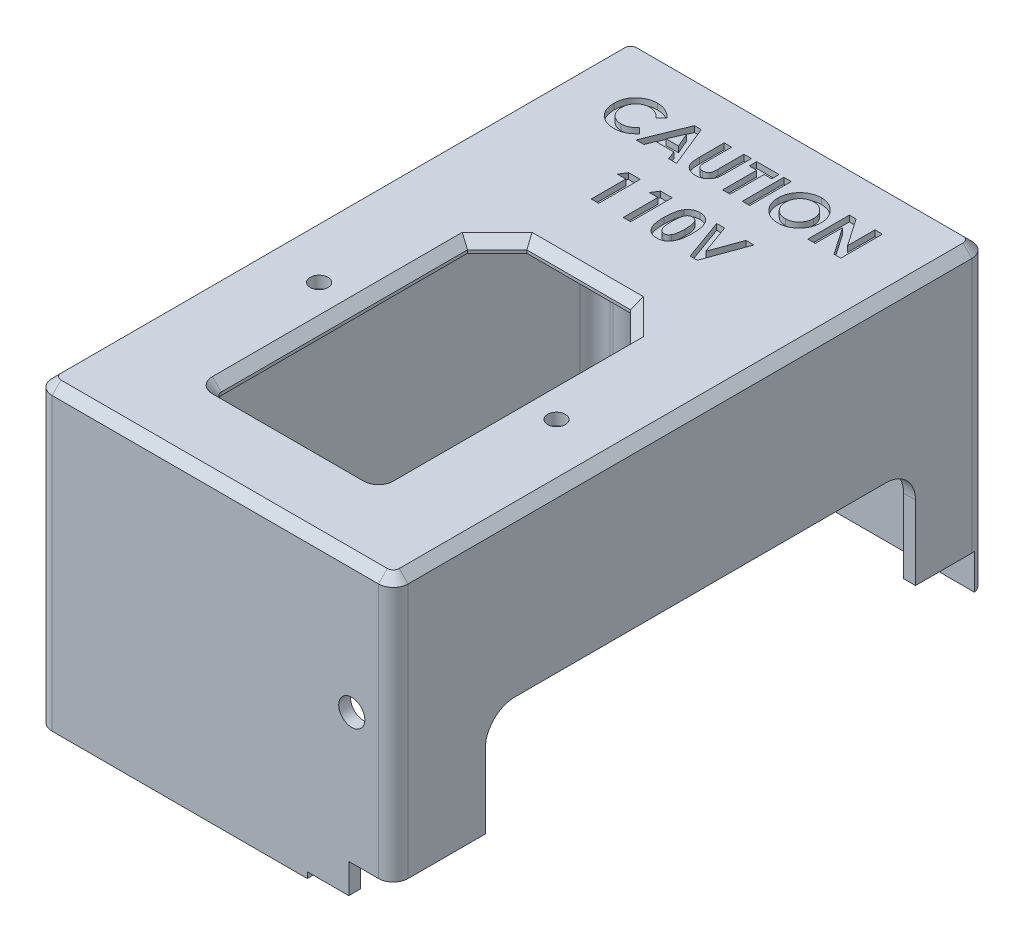
from build123d import *

# Parameters (mm, degrees)
SKETCH1_W           = 60
SKETCH1_H           = 100
SKETCH1_R           = 1.5
BOSS_EXTRUDE1_DEPTH = 2
SKETCH2_W           = 60
SKETCH2_H           = 100
SKETCH2_W_2         = 56
SKETCH2_H_2         = 96
BOSS_EXTRUDE2_DEPTH = 25
BOSS_EXTRUDE3_DEPTH = 17.5
BOSS_EXTRUDE4_DEPTH = 5
FILLET1_R           = 2.5
CHAMFER1_SIZE       = 1.5
CUT_EXTRUDE1_REACH  = 127.922
BOSS_EXTRUDE5_DEPTH = 47.5
SKETCH9_R           = 1.5
CUT_EXTRUDE2_DEPTH  = 42.5
FILLET2_R           = 2.5
WRAP2_START         = -1
WRAP2_OUTLINE_W     = 1.256410257
WRAP2_OUTLINE_H     = 7
WRAP2_DEPTH         = 1
BOSS_EXTRUDE6_START = 1
SKETCH11_R          = 1.5
BOSS_EXTRUDE6_DEPTH = 1
FILLET3_R           = 5
BOSS_EXTRUDE7_DEPTH = 5
BOSS_EXTRUDE8_DEPTH = 1
CUT_EXTRUDE3_REACH  = 128.302
SKETCH15_R          = 2.2


# Read off the part's stored shape, not the designer's step: Wrap2
with BuildPart() as part:
    # Sketch1 → Boss-Extrude1 (new body)
    with BuildSketch(Plane(origin=(0, 0, 0), x_dir=(1, 0, 0), z_dir=(0, 1, 0))):
        with Locations((30, 50)):
            Rectangle(SKETCH1_W, SKETCH1_H)
        with Locations(Location((50, 37.5, 0), (0, 0, 270))):
            Circle(SKETCH1_R, mode=Mode.SUBTRACT)
        with Locations(Location((10, 37.5, 0), (0, 0, 270))):
            Circle(SKETCH1_R, mode=Mode.SUBTRACT)
        with BuildLine():
            Line((16.25, 56.25), (21.25, 61.25))
            Line((21.25, 61.25), (38.75, 61.25))
            Line((38.75, 61.25), (43.75, 56.25))
            Line((43.75, 56.25), (43.75, 14.75))
            ThreePointArc((43.75, 14.75), (43.457106781, 14.042893219), (42.75, 13.75))
            Line((42.75, 13.75), (17.25, 13.75))
            ThreePointArc((17.25, 13.75), (16.542893219, 14.042893219), (16.25, 14.75))
            Line((16.25, 14.75), (16.25, 56.25))
        make_face(mode=Mode.SUBTRACT)
    extrude(amount=BOSS_EXTRUDE1_DEPTH)

    # Sketch2 → Boss-Extrude2 (add)
    with BuildSketch(Plane.XZ):
        with Locations((30, -50)):
            Rectangle(SKETCH2_W, SKETCH2_H)
        with Locations((30, -50)):
            Rectangle(SKETCH2_W_2, SKETCH2_H_2, mode=Mode.SUBTRACT)
    extrude(amount=BOSS_EXTRUDE2_DEPTH)

    # Sketch3 → Boss-Extrude3 (add)
    with BuildSketch(Plane.XZ.offset(25)):
        Polygon((58.450874289, 0), (0, 0), (0, -100), (58, -100), (60, -100), (60, -88), (58, -88), (58, -98), (2, -98), (2, -2), (58, -2), (58, -15.5), (60, -15.5), (60, 0), align=None)
    extrude(amount=BOSS_EXTRUDE3_DEPTH)

    # Sketch5 → Boss-Extrude4 (add)
    with BuildSketch(Plane.XZ.offset(42.5)):
        Polygon((52.5, 0), (0, 0), (0, -2), (0, -98), (0, -100), (52.5, -100), (52.5, -98), (2, -98), (2, -2), (52.5, -2), align=None)
    extrude(amount=BOSS_EXTRUDE4_DEPTH)

    # Fillet1
    fillet1_edges = [part.edges().sort_by_distance(p)[0] for p in [
        (2, -23.75, -2),
        (2, -23.75, -98),
        (0, -22.75, -100),
        (60, -20.25, -100),
        (60, -20.25, 0),
        (0, -22.75, 0),
    ]]
    fillet(fillet1_edges, radius=FILLET1_R)

    # Chamfer1
    chamfer1_edges = [part.edges().sort_by_distance(p)[0] for p in [
        (60, 2, -50),
        (30, 2, 0),
        (0, 2, -50),
        (30, 2, -100),
        (0.732233047, 2, -99.267766953),
        (0.732233047, 2, -0.732233047),
        (59.267766953, 2, -99.267766953),
        (59.267766953, 2, -0.732233047),
        (41.25, 2, -58.75),
        (30, 2, -61.25),
        (18.75, 2, -58.75),
        (16.25, 2, -35.5),
        (16.542893219, 2, -14.042893219),
        (30, 2, -13.75),
        (43.457106781, 2, -14.042893219),
        (43.75, 2, -35.5),
    ]]
    chamfer(chamfer1_edges, length=CHAMFER1_SIZE)

    # Sketch7 → Cut-Extrude1 (cut, up to next)
    with BuildSketch(Plane.ZY, mode=Mode.PRIVATE) as cut_extrude1_sk1:
        with BuildLine():
            Line((-58.75, -47.5), (-58.75, -45))
            ThreePointArc((-58.75, -45), (-58.017766953, -43.232233047), (-56.25, -42.5))
            Line((-56.25, -42.5), (-46.25, -42.5))
            ThreePointArc((-46.25, -42.5), (-44.482233047, -43.232233047), (-43.75, -45))
            Line((-43.75, -45), (-43.75, -47.5))
            Line((-43.75, -47.5), (-58.75, -47.5))
        make_face()
    cut_extrude1_tool1 = extrude(cut_extrude1_sk1.sketch, amount=-CUT_EXTRUDE1_REACH, mode=Mode.PRIVATE) & part.part
    add(cut_extrude1_tool1.solids().sort_by_distance((0, -45.07202, -51.25))[0], mode=Mode.SUBTRACT)

    # Sketch8 → Boss-Extrude5 (add)
    with BuildSketch(Plane.XZ.offset(47.5)):
        with BuildLine():
            Line((5, -92), (2, -92))
            Line((2, -92), (2, -95.5))
            ThreePointArc((2, -95.5), (2.732233047, -97.267766953), (4.5, -98))
            Line((4.5, -98), (8, -98))
            Line((8, -98), (8, -95))
            ThreePointArc((8, -95), (7.121320344, -92.878679656), (5, -92))
        make_face()
        with BuildLine():
            Line((8, -5), (8, -2))
            Line((8, -2), (4.5, -2))
            ThreePointArc((4.5, -2), (2.732233047, -2.732233047), (2, -4.5))
            Line((2, -4.5), (2, -8))
            Line((2, -8), (5, -8))
            ThreePointArc((5, -8), (7.121320344, -7.121320344), (8, -5))
        make_face()
    extrude(amount=-BOSS_EXTRUDE5_DEPTH)

    # Sketch9 → Cut-Extrude2 (cut)
    with BuildSketch(Plane.XZ.offset(47.5)):
        with Locations(Location((5, -5, 0), (0, 0, 270))):
            Circle(SKETCH9_R)
        with Locations(Location((5, -95, 0), (0, 0, 270))):
            Circle(SKETCH9_R)
    extrude(amount=-CUT_EXTRUDE2_DEPTH, mode=Mode.SUBTRACT)

    # Fillet2
    fillet2_edges = [part.edges().sort_by_distance(p)[0] for p in [
        (2, -23.75, -8),
        (8, -23.75, -2),
        (8, -23.75, -98),
        (2, -23.75, -92),
    ]]
    fillet(fillet2_edges, radius=FILLET2_R)

    # Wrap2 outline → Wrap2 (cut)
    # profile 1 of 11: a face of its own
    with BuildSketch(Plane(origin=(0, 2, 0), x_dir=(1, 0, 0), z_dir=(0, 1, 0)).offset(WRAP2_START)):
        with BuildLine():
            add(Edge.make_bspline(
                [(43.596153846, 88.478966346), (43.592880746, 88.353544519), (43.586430998, 88.106396785), (43.536600624, 87.743190399), (43.453381259, 87.394906439), (43.338733521, 87.060756556), (43.188395151, 86.742359259), (43.007255065, 86.437681624), (42.790533321, 86.149551132), (42.546134612, 85.878122407), (42.277072843, 85.631742596), (41.992093717, 85.414620814), (41.692513091, 85.230640009), (41.378769455, 85.079884454), (41.050190002, 84.962888619), (40.707586363, 84.880339557), (40.350979738, 84.830172825), (40.108469939, 84.823765206), (39.985376603, 84.820512821)],
                knots=[0, 0, 0, 0, 0.065722315, 0.129507931, 0.191722103, 0.253161125, 0.314315704, 0.37595174, 0.438619601, 0.502972902, 0.567128646, 0.62955229, 0.690476782, 0.751072338, 0.811667894, 0.872929356, 0.935501371, 1, 1, 1, 1], degree=3))
            add(Edge.make_bspline(
                [(39.975560897, 92.179487179), (40.097264476, 92.176336056), (40.337534907, 92.170115024), (40.690886005, 92.11825787), (41.031405122, 92.033764071), (41.358938277, 91.916311579), (41.672665364, 91.762719183), (41.973693004, 91.57734133), (42.26094293, 91.356679122), (42.531471635, 91.105880246), (42.781488949, 90.833147419), (42.998129097, 90.539502043), (43.182871868, 90.232552764), (43.335987171, 89.911477103), (43.452612974, 89.574051457), (43.534454123, 89.221996252), (43.587033007, 88.855411644), (43.593080388, 88.605817493), (43.596153846, 88.478966346)],
                knots=[0, 0, 0, 0, 0.063395597, 0.125157267, 0.185649467, 0.245976679, 0.306108369, 0.367350588, 0.429902078, 0.494539958, 0.559372583, 0.622409686, 0.684357426, 0.745806601, 0.807430275, 0.869995516, 0.933927868, 1, 1, 1, 1], degree=3))
            add(Edge.make_bspline(
                [(36.326923077, 88.502804487), (36.327990689, 88.585603998), (36.330112394, 88.750154589), (36.355670573, 88.994010164), (36.392467001, 89.233106006), (36.446887172, 89.466488836), (36.512993772, 89.695805061), (36.598644209, 89.918920149), (36.696137586, 90.138217583), (36.810049418, 90.351107186), (36.93670836, 90.555630195), (37.074904543, 90.750821839), (37.224985459, 90.934321967), (37.386467648, 91.107336465), (37.559907598, 91.268728097), (37.743023888, 91.420781585), (37.939367906, 91.55945785), (38.144642297, 91.68814364), (38.357689773, 91.804511969), (38.577643037, 91.90356121), (38.799970617, 91.990059226), (39.027642509, 92.058327284), (39.258218805, 92.113930903), (39.494162744, 92.150702531), (39.733342708, 92.176260001), (39.89462989, 92.1784089), (39.975560897, 92.179487179)],
                knots=[0, 0, 0, 0, 0.043114346, 0.085682765, 0.127594324, 0.169058623, 0.210432029, 0.251811166, 0.29344384, 0.335380853, 0.377476606, 0.418688491, 0.459873034, 0.500872905, 0.541872776, 0.583211777, 0.624763202, 0.666987622, 0.709369706, 0.751102652, 0.79256838, 0.833545109, 0.874827423, 0.916017723, 0.957859204, 1, 1, 1, 1], degree=3))
            add(Edge.make_bspline(
                [(39.985376603, 84.820512821), (39.856635732, 84.82343037), (39.603677519, 84.829162956), (39.233472041, 84.883677235), (38.878783205, 84.965794782), (38.542590601, 85.088350815), (38.221470395, 85.241556163), (37.917781951, 85.430237733), (37.631627329, 85.654083716), (37.364647958, 85.907361332), (37.122764001, 86.184502596), (36.909253963, 86.477277765), (36.72915351, 86.783450294), (36.582456052, 87.103163478), (36.466805669, 87.434430378), (36.385227464, 87.779268505), (36.337037272, 88.136850811), (36.330324658, 88.379727861), (36.326923077, 88.502804487)],
                knots=[0, 0, 0, 0, 0.066748651, 0.131151976, 0.193732197, 0.255325543, 0.316388186, 0.378026863, 0.440405679, 0.504557429, 0.568658287, 0.630986179, 0.692288135, 0.752615447, 0.813199538, 0.874016125, 0.936158356, 1, 1, 1, 1], degree=3))
        make_face()
        with BuildLine():
            add(Edge.make_bspline(
                [(37.583333333, 88.485977564), (37.586176788, 88.390029231), (37.591749488, 88.201986397), (37.630959683, 87.927674577), (37.698044423, 87.668614288), (37.794913483, 87.426072556), (37.915056532, 87.197356136), (38.06425513, 86.985268273), (38.240092968, 86.788539084), (38.375557013, 86.673680389), (38.444310897, 86.615384615)],
                knots=[0, 0, 0, 0, 0.134806833, 0.264199056, 0.388461817, 0.509942098, 0.630409611, 0.750671035, 0.873454726, 1, 1, 1, 1], degree=3))
            add(Edge.make_bspline(
                [(39.955929487, 90.923076923), (39.874022995, 90.920879188), (39.712372354, 90.916541738), (39.475260304, 90.883496239), (39.247624363, 90.83071882), (39.030726405, 90.754271373), (38.823626378, 90.656973176), (38.625957156, 90.539164201), (38.44045605, 90.396794894), (38.264649581, 90.237508431), (38.105837366, 90.060026704), (37.965521765, 89.86982485), (37.848100206, 89.667220503), (37.749758915, 89.454095808), (37.675729719, 89.228054236), (37.623000942, 88.990866394), (37.589678323, 88.742123597), (37.585477965, 88.572555955), (37.583333333, 88.485977564)],
                knots=[0, 0, 0, 0, 0.064608735, 0.12751179, 0.188521308, 0.248708179, 0.308598265, 0.368812249, 0.429887502, 0.492802448, 0.555743332, 0.617485295, 0.678968963, 0.740197691, 0.802360102, 0.866244776, 0.931706828, 1, 1, 1, 1], degree=3))
            add(Edge.make_bspline(
                [(42.33974359, 88.495793269), (42.337529107, 88.579093697), (42.333170237, 88.743057885), (42.300474099, 88.984099473), (42.245587944, 89.215058869), (42.169583572, 89.436313255), (42.072530013, 89.648079541), (41.952513442, 89.849613034), (41.809954982, 90.040718898), (41.648135607, 90.22009482), (41.472005162, 90.384929803), (41.282911531, 90.527976604), (41.086145766, 90.652279726), (40.8771931, 90.749653772), (40.660328529, 90.827231469), (40.434228735, 90.884360798), (40.19803735, 90.916309592), (40.037351467, 90.920801039), (39.955929487, 90.923076923)],
                knots=[0, 0, 0, 0, 0.065939124, 0.129791109, 0.192175236, 0.253617044, 0.314719108, 0.376282275, 0.438972992, 0.503174702, 0.567329465, 0.629650994, 0.690649867, 0.751237613, 0.811754114, 0.872787777, 0.935539633, 1, 1, 1, 1], degree=3))
            add(Edge.make_bspline(
                [(39.981169872, 86.076923077), (40.06166798, 86.079139446), (40.22005054, 86.083500223), (40.452748621, 86.116138914), (40.675680451, 86.171375364), (40.890230008, 86.247152187), (41.095778628, 86.345672047), (41.291321739, 86.467135087), (41.477202181, 86.610049899), (41.652784674, 86.771428142), (41.813275373, 86.949609024), (41.953298165, 87.140825395), (42.074453142, 87.340864187), (42.170749424, 87.552556644), (42.247703347, 87.773904489), (42.299797506, 88.005888025), (42.333401625, 88.247550926), (42.337603166, 88.412011071), (42.33974359, 88.495793269)],
                knots=[0, 0, 0, 0, 0.064147445, 0.126212115, 0.186841289, 0.246935869, 0.307256361, 0.368150502, 0.430070767, 0.493875442, 0.557980682, 0.620869526, 0.682524731, 0.744035698, 0.805888683, 0.868968138, 0.933247429, 1, 1, 1, 1], degree=3))
            add(Edge.make_bspline(
                [(38.444310897, 86.615384615), (38.500633454, 86.572317936), (38.612009612, 86.487154878), (38.789790207, 86.378000948), (38.972869214, 86.284445142), (39.162628193, 86.208853157), (39.358666382, 86.149393772), (39.5609569, 86.107755343), (39.769213116, 86.081623627), (39.91004573, 86.078500392), (39.981169872, 86.076923077)],
                knots=[0, 0, 0, 0, 0.127991026, 0.253098392, 0.376184058, 0.498936312, 0.621525881, 0.745706894, 0.87157535, 1, 1, 1, 1], degree=3))
        make_face(mode=Mode.SUBTRACT)
    # profile 2 of 11: a face of its own
    with BuildSketch(Plane(origin=(0, 2, 0), x_dir=(1, 0, 0), z_dir=(0, 1, 0)).offset(WRAP2_START)):
        with BuildLine():
            add(Edge.make_bspline(
                [(25.019230769, 87.445512821), (25.019299087, 87.398293873), (25.019431041, 87.307090963), (25.026036744, 87.176244648), (25.032081418, 87.055969489), (25.042987725, 86.94639716), (25.059100079, 86.84748079), (25.074702095, 86.758584977), (25.095817881, 86.681301299), (25.127551531, 86.593332239), (25.176442669, 86.494494196), (25.256328075, 86.391482921), (25.348509, 86.29747018), (25.458993149, 86.219217537), (25.58316756, 86.155918201), (25.720349952, 86.109020399), (25.870346946, 86.082951448), (25.974061639, 86.078971545), (26.02744391, 86.076923077)],
                knots=[0, 0, 0, 0, 0.072218748, 0.139489766, 0.200369998, 0.256432726, 0.307803522, 0.353658517, 0.394419906, 0.430155706, 0.496666273, 0.562017618, 0.628754548, 0.697409641, 0.768079195, 0.841338126, 0.918336247, 1, 1, 1, 1], degree=3))
            Line((25.019230769, 87.445512821), (25.019230769, 92))
            Line((25.019230769, 92), (23.762820513, 92))
            Line((23.762820513, 92), (23.762820513, 87.82411859))
            add(Edge.make_bspline(
                [(26.055488782, 84.820512821), (25.995147759, 84.821529185), (25.876096159, 84.823534452), (25.701009896, 84.841215669), (25.531754629, 84.867271134), (25.368648388, 84.905283374), (25.211125061, 84.954388089), (25.059226498, 85.014832573), (24.913517192, 85.086279675), (24.774812512, 85.168072236), (24.643283144, 85.25651681), (24.523072092, 85.354561343), (24.410042609, 85.454955073), (24.307460073, 85.561922992), (24.214553995, 85.674342121), (24.131515716, 85.792467239), (24.058468603, 85.916287852), (23.993575197, 86.048035819), (23.938032775, 86.194407416), (23.891208426, 86.360609139), (23.850301574, 86.549246034), (23.819902015, 86.760743091), (23.792341596, 86.994403239), (23.77489737, 87.250835198), (23.76577151, 87.530046325), (23.763829034, 87.723617611), (23.762820513, 87.82411859)],
                knots=[0, 0, 0, 0, 0.041714932, 0.082302706, 0.121571814, 0.160067124, 0.197993763, 0.235566172, 0.273004881, 0.310090333, 0.346846143, 0.382483572, 0.417271008, 0.451331619, 0.484852741, 0.518030851, 0.551068546, 0.584171, 0.619466744, 0.659157907, 0.703471547, 0.752840114, 0.806844312, 0.866141938, 0.930501747, 1, 1, 1, 1], degree=3))
            add(Edge.make_bspline(
                [(28.33974359, 87.82411859), (28.339569114, 87.739515432), (28.339233615, 87.576831811), (28.334081359, 87.343043998), (28.323113138, 87.129516333), (28.313901098, 86.936186422), (28.296072645, 86.763314714), (28.277499579, 86.610162996), (28.253826609, 86.477274004), (28.218602654, 86.325996036), (28.157816534, 86.151804995), (28.059821339, 85.951231564), (27.935422782, 85.754858025), (27.788389905, 85.564844623), (27.622376338, 85.388328296), (27.441062955, 85.23336981), (27.247330377, 85.102291639), (27.039154237, 84.998298805), (26.816711703, 84.917192234), (26.577801873, 84.862692703), (26.322587664, 84.825872136), (26.146306386, 84.822335068), (26.055488782, 84.820512821)],
                knots=[0, 0, 0, 0, 0.058540417, 0.112567512, 0.161779878, 0.206487156, 0.24645703, 0.281999707, 0.313212938, 0.339806474, 0.389412612, 0.44047348, 0.49395474, 0.549977877, 0.606488084, 0.6613185, 0.714691099, 0.767918471, 0.82193879, 0.878107374, 0.937202655, 1, 1, 1, 1], degree=3))
            Line((28.33974359, 87.82411859), (28.33974359, 92))
            Line((28.33974359, 92), (27.083333333, 92))
            Line((27.083333333, 92), (27.083333333, 87.612379808))
            add(Edge.make_bspline(
                [(26.02744391, 86.076923077), (26.084155985, 86.078577976), (26.19473493, 86.08180475), (26.353785139, 86.113479026), (26.501146059, 86.163915321), (26.633697558, 86.235900768), (26.751307725, 86.322187942), (26.850862267, 86.42058236), (26.929430346, 86.53128027), (26.980638096, 86.633407521), (27.009388726, 86.727406763), (27.030938756, 86.811391518), (27.046737312, 86.910485216), (27.061070281, 87.023140295), (27.069683291, 87.150523645), (27.079022696, 87.291610832), (27.082445675, 87.447367212), (27.083029097, 87.555823303), (27.083333333, 87.612379808)],
                knots=[0, 0, 0, 0, 0.078832604, 0.153710231, 0.224677759, 0.294808775, 0.362714787, 0.427103243, 0.488649766, 0.550900247, 0.585045833, 0.62527219, 0.671465864, 0.724549993, 0.783264732, 0.849073131, 0.921296295, 1, 1, 1, 1], degree=3))
        make_face()
    # profile 3 of 11: a face of its own
    with BuildSketch(Plane(origin=(0, 2, 0), x_dir=(1, 0, 0), z_dir=(0, 1, 0)).offset(WRAP2_START)):
        with BuildLine():
            add(Edge.make_bspline(
                [(34.307692308, 76.099759615), (34.307023777, 75.986631647), (34.305724834, 75.766826032), (34.291729638, 75.446899403), (34.267629249, 75.14624813), (34.236566928, 74.864903318), (34.194020045, 74.603013541), (34.144191731, 74.35990068), (34.084979533, 74.135652858), (34.013493974, 73.930775352), (33.936568465, 73.741967972), (33.851918095, 73.566970465), (33.761018305, 73.40530884), (33.665954065, 73.254544212), (33.561513602, 73.119121045), (33.452780329, 72.994434244), (33.335019804, 72.885233289), (33.2131902, 72.785890453), (33.082828408, 72.700038306), (32.945278812, 72.624953434), (32.798089144, 72.564050685), (32.64394242, 72.511080726), (32.480211179, 72.473054012), (32.309497086, 72.442881063), (32.129872815, 72.426205641), (32.007577376, 72.424136945), (31.944911859, 72.423076923)],
                knots=[0, 0, 0, 0, 0.068490874, 0.13307654, 0.193828987, 0.251082857, 0.304400837, 0.354408344, 0.401294782, 0.444700685, 0.485692492, 0.524676484, 0.562306759, 0.597946585, 0.632473549, 0.665752043, 0.6979853, 0.729586224, 0.760825197, 0.79235508, 0.824312604, 0.857156272, 0.890926887, 0.925960443, 0.962061323, 1, 1, 1, 1], degree=3))
            add(Edge.make_bspline(
                [(31.908453526, 79.782051282), (31.969268997, 79.781148459), (32.088848462, 79.779373268), (32.264966505, 79.760146505), (32.434616873, 79.731100229), (32.598463262, 79.690590801), (32.755326286, 79.636978017), (32.906347628, 79.572804434), (33.049729698, 79.494704014), (33.187301073, 79.406485578), (33.319008763, 79.306609804), (33.441687264, 79.192746263), (33.557576947, 79.067514963), (33.664169226, 78.929022629), (33.763824621, 78.778528996), (33.856215681, 78.616010202), (33.940635128, 78.440670824), (34.018029104, 78.25219445), (34.087235042, 78.047755901), (34.145527117, 77.825010176), (34.195522326, 77.583906409), (34.23772181, 77.323844455), (34.269617799, 77.04447863), (34.291116338, 76.745994531), (34.305869653, 76.428967591), (34.307073716, 76.211489715), (34.307692308, 76.099759615)],
                knots=[0, 0, 0, 0, 0.03663489, 0.072033982, 0.106625971, 0.140305694, 0.17361947, 0.206425673, 0.239067006, 0.271882881, 0.304839889, 0.338529034, 0.372616188, 0.40754825, 0.443718906, 0.481311509, 0.520112998, 0.560912903, 0.604024601, 0.650074564, 0.699572228, 0.752362539, 0.808788717, 0.868954213, 0.93267472, 1, 1, 1, 1], degree=3))
            add(Edge.make_bspline(
                [(30.126201923, 78.829927885), (30.180553967, 78.905645988), (30.286822923, 79.053689799), (30.472637162, 79.24804365), (30.67227037, 79.414264581), (30.889822898, 79.548590863), (31.121854063, 79.654520579), (31.37035597, 79.729337545), (31.634410943, 79.772929396), (31.815741898, 79.778965247), (31.908453526, 79.782051282)],
                knots=[0, 0, 0, 0, 0.132314034, 0.258700009, 0.380911821, 0.500534869, 0.620922618, 0.742375765, 0.868280834, 1, 1, 1, 1], degree=3))
            add(Edge.make_bspline(
                [(29.551282051, 76.033854167), (29.552480767, 76.189089697), (29.554793704, 76.488618653), (29.584104945, 76.921350907), (29.627126412, 77.321336915), (29.690314756, 77.6879076), (29.76844627, 78.022420632), (29.868497742, 78.322672415), (29.982399065, 78.592817606), (30.079457625, 78.752853244), (30.126201923, 78.829927885)],
                knots=[0, 0, 0, 0, 0.161071124, 0.310788808, 0.449903824, 0.578376317, 0.696617212, 0.805987323, 0.906561703, 1, 1, 1, 1], degree=3))
            add(Edge.make_bspline(
                [(31.944911859, 72.423076923), (31.882248033, 72.424157393), (31.75949052, 72.426274016), (31.579380527, 72.442757074), (31.407761735, 72.473176243), (31.242735116, 72.511372667), (31.085449229, 72.563933483), (30.935149893, 72.626658399), (30.792992779, 72.701274779), (30.658584277, 72.787326953), (30.532383296, 72.886005111), (30.412428673, 72.996253779), (30.298985755, 73.117793504), (30.19378029, 73.251985633), (30.095089316, 73.39703898), (30.003942026, 73.554609984), (29.920393195, 73.724469226), (29.841829401, 73.906853471), (29.773567408, 74.105689243), (29.712817404, 74.322752121), (29.663052599, 74.559851502), (29.623028413, 74.816911217), (29.591073126, 75.093386672), (29.567302065, 75.389411315), (29.553229132, 75.705123026), (29.551943811, 75.922127412), (29.551282051, 76.033854167)],
                knots=[0, 0, 0, 0, 0.038217338, 0.074867203, 0.110158082, 0.144453927, 0.178079726, 0.211170773, 0.243687054, 0.275871733, 0.308375516, 0.341263325, 0.375150339, 0.409655261, 0.445157367, 0.482073467, 0.520575756, 0.560553681, 0.603107575, 0.64868871, 0.697947678, 0.750767767, 0.807309402, 0.867655571, 0.931861222, 1, 1, 1, 1], degree=3))
        make_face()
        with BuildLine():
            add(Edge.make_bspline(
                [(30.807692308, 76.019831731), (30.808973791, 75.913252237), (30.811431131, 75.708878155), (30.82430153, 75.414981109), (30.850099175, 75.147511132), (30.882186237, 74.904655481), (30.927253826, 74.687989139), (30.979107004, 74.495462243), (31.043141069, 74.329529042), (31.117144768, 74.18778977), (31.1991072, 74.067212465), (31.288081026, 73.964721213), (31.381037005, 73.875968624), (31.480876596, 73.80387599), (31.587361611, 73.748627519), (31.699603097, 73.708887975), (31.817672382, 73.684561746), (31.89852501, 73.68118848), (31.939302885, 73.679487179)],
                knots=[0, 0, 0, 0, 0.11073428, 0.212341193, 0.305502126, 0.389834841, 0.466690458, 0.535261854, 0.596762914, 0.651065719, 0.701035551, 0.747860271, 0.791833397, 0.834284007, 0.87533389, 0.916034749, 0.957652281, 1, 1, 1, 1], degree=3))
            add(Edge.make_bspline(
                [(31.939302885, 78.525641026), (31.884325194, 78.523035192), (31.776539738, 78.517926376), (31.620137904, 78.474559733), (31.472660741, 78.407577615), (31.360478801, 78.326975108), (31.276511736, 78.249707939), (31.217843344, 78.179783664), (31.161266928, 78.101753213), (31.111295788, 78.012095472), (31.064109988, 77.91403195), (31.017995238, 77.807117498), (30.980193252, 77.688726065), (30.943053803, 77.560873873), (30.91051618, 77.420026147), (30.883256785, 77.265031615), (30.858902912, 77.09488233), (30.841915795, 76.909466847), (30.826078705, 76.708979154), (30.814725928, 76.492972644), (30.809979617, 76.26150559), (30.808470909, 76.102097664), (30.807692308, 76.019831731)],
                knots=[0, 0, 0, 0, 0.053833701, 0.10554263, 0.158054172, 0.211987336, 0.24020689, 0.26979351, 0.301343099, 0.334608061, 0.370284442, 0.408088838, 0.448681346, 0.492069297, 0.538664157, 0.590371054, 0.646387784, 0.707195376, 0.772946775, 0.843642601, 0.919308357, 1, 1, 1, 1], degree=3))
            add(Edge.make_bspline(
                [(33.051282051, 76.099759615), (33.05082036, 76.210093698), (33.049931683, 76.422467973), (33.033627029, 76.727356228), (33.010921552, 77.005821048), (32.977709995, 77.257240735), (32.93497729, 77.482225625), (32.88230907, 77.680761011), (32.820217157, 77.853238168), (32.746583547, 77.999485112), (32.66502975, 78.123774954), (32.578457904, 78.230405996), (32.486501949, 78.321444891), (32.389315665, 78.397234232), (32.284649642, 78.455142972), (32.174503137, 78.496031334), (32.058650341, 78.520767421), (31.979622333, 78.523994564), (31.939302885, 78.525641026)],
                knots=[0, 0, 0, 0, 0.112114796, 0.215801843, 0.310202692, 0.395992925, 0.473410231, 0.54277842, 0.604548022, 0.659357266, 0.708764362, 0.755355506, 0.798686994, 0.840016839, 0.880203447, 0.919733348, 0.959048606, 1, 1, 1, 1], degree=3))
            add(Edge.make_bspline(
                [(32.706330128, 74.160456731), (32.734640354, 74.212236481), (32.794004603, 74.320814418), (32.862701014, 74.504035638), (32.920525824, 74.710678891), (32.970294792, 74.941387272), (33.00433373, 75.197070723), (33.033648023, 75.476107932), (33.047787034, 75.779904019), (33.050086821, 75.990375043), (33.051282051, 76.099759615)],
                knots=[0, 0, 0, 0, 0.088870731, 0.186354716, 0.294077654, 0.412236528, 0.541778144, 0.682702607, 0.835096353, 1, 1, 1, 1], degree=3))
            add(Edge.make_bspline(
                [(31.939302885, 73.679487179), (31.978681391, 73.680651336), (32.055779611, 73.682930609), (32.168206082, 73.70632704), (32.274524542, 73.744364556), (32.374413982, 73.798171293), (32.468231692, 73.866594791), (32.55551915, 73.949935733), (32.635618051, 74.049024834), (32.682284034, 74.122563601), (32.706330128, 74.160456731)],
                knots=[0, 0, 0, 0, 0.124035433, 0.242845955, 0.360341682, 0.479042432, 0.59933411, 0.725488476, 0.858549429, 1, 1, 1, 1], degree=3))
        make_face(mode=Mode.SUBTRACT)
    # profile 4 of 11: a face of its own
    with BuildSketch(Plane(origin=(0, 2, 0), x_dir=(1, 0, 0), z_dir=(0, 1, 0)).offset(WRAP2_START)):
        with BuildLine():
            add(Edge.make_bspline(
                [(14.405649038, 89.905048077), (14.327499069, 89.985855276), (14.174847695, 90.143697053), (13.928868885, 90.352665654), (13.673059879, 90.526812709), (13.41239693, 90.67347825), (13.142191468, 90.784441185), (12.865567804, 90.865301745), (12.580759613, 90.914599372), (12.388012384, 90.920239893), (12.291065705, 90.923076923)],
                knots=[0, 0, 0, 0, 0.139406438, 0.272304448, 0.399525336, 0.522810878, 0.642662717, 0.761022621, 0.879800797, 1, 1, 1, 1], degree=3))
            Line((14.405649038, 89.905048077), (15.326923077, 90.785657051))
            add(Edge.make_bspline(
                [(12.340144231, 92.179487179), (12.410759195, 92.178429383), (12.551254925, 92.176324789), (12.760476643, 92.158780708), (12.968025104, 92.131227907), (13.17315722, 92.089656597), (13.377340306, 92.040306198), (13.577891168, 91.975688659), (13.777973603, 91.903660234), (13.974449616, 91.817564959), (14.16759346, 91.723584189), (14.352880434, 91.616959594), (14.53342149, 91.50425273), (14.705215946, 91.378793112), (14.871481884, 91.245131394), (15.031349883, 91.102643969), (15.183417009, 90.948955153), (15.278845893, 90.840364932), (15.326923077, 90.785657051)],
                knots=[0, 0, 0, 0, 0.062275778, 0.123904062, 0.185067241, 0.246840152, 0.30843533, 0.370241251, 0.432586589, 0.495924582, 0.559351071, 0.621942654, 0.684392867, 0.746985808, 0.809441465, 0.872507833, 0.935769297, 1, 1, 1, 1], degree=3))
            add(Edge.make_bspline(
                [(8.685897436, 88.511217949), (8.687050453, 88.597281987), (8.68933545, 88.767839876), (8.713350985, 89.019085465), (8.746830037, 89.264004974), (8.799941508, 89.500055325), (8.863962149, 89.730416554), (8.943580227, 89.952584902), (9.038668581, 90.167198903), (9.14616229, 90.374617834), (9.267768847, 90.57348288), (9.403616722, 90.762085475), (9.550208659, 90.941881597), (9.711067026, 91.110485917), (9.883854338, 91.269378814), (10.06935071, 91.417699216), (10.266440475, 91.557574206), (10.475657082, 91.685396746), (10.692936008, 91.801019028), (10.915536796, 91.903002819), (11.14291254, 91.988237783), (11.374101876, 92.058937041), (11.610081576, 92.111709039), (11.849167276, 92.151655738), (12.093393309, 92.173986199), (12.257369931, 92.177641837), (12.340144231, 92.179487179)],
                knots=[0, 0, 0, 0, 0.044663331, 0.088511806, 0.130925591, 0.172904037, 0.21400012, 0.25498502, 0.295291276, 0.335772442, 0.376180821, 0.416178408, 0.456350051, 0.496512167, 0.537040574, 0.578118744, 0.619724561, 0.66242197, 0.705298954, 0.747430001, 0.789432984, 0.831267421, 0.872825096, 0.91487011, 0.957027003, 1, 1, 1, 1], degree=3))
            add(Edge.make_bspline(
                [(12.320512821, 84.820512821), (12.189960293, 84.823840865), (11.934505285, 84.830352922), (11.560142632, 84.87860286), (11.20450816, 84.959493031), (10.866736678, 85.073894043), (10.54693559, 85.220035975), (10.245186709, 85.399199122), (9.961976389, 85.610907474), (9.699592411, 85.852679606), (9.462253615, 86.119696628), (9.252473605, 86.406399657), (9.078943573, 86.714197732), (8.934857848, 87.038543692), (8.822184706, 87.380917655), (8.742881915, 87.741689965), (8.693976463, 88.120512273), (8.688626137, 88.379256642), (8.685897436, 88.511217949)],
                knots=[0, 0, 0, 0, 0.067376243, 0.131836579, 0.194461068, 0.255345968, 0.31558834, 0.375627452, 0.436137852, 0.49777862, 0.559470361, 0.62027777, 0.680787689, 0.741491622, 0.803215436, 0.866492763, 0.931910443, 1, 1, 1, 1], degree=3))
            add(Edge.make_bspline(
                [(15.298878205, 86.156850962), (15.236089003, 86.096229958), (15.113537907, 85.977910722), (14.928672982, 85.809908449), (14.744040716, 85.658939731), (14.564101441, 85.519525064), (14.385907564, 85.395725937), (14.209477982, 85.28741871), (14.036809955, 85.191864136), (13.864317975, 85.110673698), (13.69092871, 85.041734583), (13.512531532, 84.982382529), (13.328581064, 84.932172828), (13.137953821, 84.891660193), (12.942427858, 84.859174528), (12.740173311, 84.837246893), (12.532472574, 84.822505673), (12.391585946, 84.821181052), (12.320512821, 84.820512821)],
                knots=[0, 0, 0, 0, 0.077782936, 0.151815657, 0.222539839, 0.290277535, 0.354640607, 0.415797753, 0.474709008, 0.5304261, 0.585579746, 0.640906165, 0.697901091, 0.755420321, 0.814521258, 0.874461831, 0.936669717, 1, 1, 1, 1], degree=3))
            Line((15.298878205, 86.156850962), (14.405649038, 87.094951923))
            add(Edge.make_bspline(
                [(12.314903846, 86.076923077), (12.40853548, 86.079631401), (12.592497293, 86.084952553), (12.862487704, 86.126563207), (13.119761669, 86.195010378), (13.325322335, 86.27584251), (13.486373688, 86.355665289), (13.608979701, 86.42949743), (13.735763876, 86.512086785), (13.864620433, 86.606550367), (13.996998756, 86.711754575), (14.130562059, 86.830003577), (14.268729589, 86.957403603), (14.359241768, 87.048331504), (14.405649038, 87.094951923)],
                knots=[0, 0, 0, 0, 0.117048429, 0.229969726, 0.340703508, 0.449355147, 0.505556512, 0.56530267, 0.628204956, 0.694728992, 0.765018834, 0.839580202, 0.9177498, 1, 1, 1, 1], degree=3))
            add(Edge.make_bspline(
                [(9.942307692, 88.514022436), (9.942982304, 88.455565852), (9.944311977, 88.340346725), (9.958867599, 88.169905657), (9.982305584, 88.004537527), (10.016226155, 87.844492824), (10.058644162, 87.689632851), (10.108410143, 87.538621639), (10.170840834, 87.393545824), (10.240139843, 87.252720443), (10.320733791, 87.119988094), (10.407628936, 86.993416783), (10.501852533, 86.87362695), (10.604014874, 86.761108301), (10.715553768, 86.657619248), (10.833586346, 86.560047755), (10.960103655, 86.470836364), (11.092477609, 86.387746219), (11.231851753, 86.315565103), (11.374444543, 86.250182957), (11.522417972, 86.197082934), (11.673970376, 86.154279471), (11.828560159, 86.117881518), (11.987699354, 86.09547018), (12.150008422, 86.078498336), (12.259702108, 86.077450423), (12.314903846, 86.076923077)],
                knots=[0, 0, 0, 0, 0.045985853, 0.090639062, 0.134485273, 0.177331356, 0.219264833, 0.260785002, 0.302316572, 0.343435729, 0.384181474, 0.424375739, 0.464181122, 0.504011983, 0.543822462, 0.583802465, 0.624418535, 0.66554756, 0.70667494, 0.747826979, 0.788895117, 0.830219358, 0.871706937, 0.913733854, 0.956587828, 1, 1, 1, 1], degree=3))
            add(Edge.make_bspline(
                [(12.291065705, 90.923076923), (12.210103447, 90.92083557), (12.05033335, 90.916412506), (11.81574898, 90.883987086), (11.591356907, 90.828846247), (11.376389, 90.752851958), (11.171477813, 90.654519381), (10.976193723, 90.533924623), (10.791018195, 90.392156826), (10.618397291, 90.229949504), (10.460489755, 90.052725815), (10.320968392, 89.863628562), (10.20409687, 89.663090955), (10.108182313, 89.453143893), (10.033468581, 89.232815637), (9.980113589, 89.002254519), (9.949254488, 88.76118596), (9.94464856, 88.59730935), (9.942307692, 88.514022436)],
                knots=[0, 0, 0, 0, 0.064714517, 0.127706968, 0.188882163, 0.249158299, 0.309661029, 0.370224886, 0.432332222, 0.495781859, 0.559304077, 0.621860558, 0.683321537, 0.744522975, 0.806088371, 0.868994315, 0.933419057, 1, 1, 1, 1], degree=3))
        make_face()
    # profile 5 of 11: a face of its own
    with BuildSketch(Plane(origin=(0, 2, 0), x_dir=(1, 0, 0), z_dir=(0, 1, 0)).offset(WRAP2_START)):
        Polygon((50.416666667, 85), (50.416666667, 92), (49.16025641, 92), (49.16025641, 87.393629808), (45.984174679, 92), (44.852564103, 92), (44.852564103, 85), (46.108974359, 85), (46.108974359, 89.592347756), (49.276642628, 85), align=None)
    # profile 6 of 11: a face of its own
    with BuildSketch(Plane(origin=(0, 2, 0), x_dir=(1, 0, 0), z_dir=(0, 1, 0)).offset(WRAP2_START)):
        with Locations((34.442307693, 88.5)):
            Rectangle(WRAP2_OUTLINE_W, WRAP2_OUTLINE_H)
    # profile 7 of 11: a face of its own
    with BuildSketch(Plane(origin=(0, 2, 0), x_dir=(1, 0, 0), z_dir=(0, 1, 0)).offset(WRAP2_START)):
        Polygon((33.006410256, 90.743589744), (33.006410256, 92), (29.237179487, 92), (29.237179487, 90.743589744), (30.493589744, 90.743589744), (30.493589744, 85), (31.75, 85), (31.75, 90.743589744), align=None)
    # profile 8 of 11: a face of its own
    with BuildSketch(Plane(origin=(0, 2, 0), x_dir=(1, 0, 0), z_dir=(0, 1, 0)).offset(WRAP2_START)):
        Polygon((22.730769231, 85), (19.903846154, 92), (18.738581731, 92), (15.91025641, 85), (17.250801282, 85), (17.794871795, 86.435897436), (20.844751603, 86.435897436), (21.388822115, 85), align=None)
        Polygon((19.320512821, 90.122395833), (20.369391026, 87.692307692), (18.271634615, 87.692307692), align=None, mode=Mode.SUBTRACT)
    # profile 9 of 11: a face of its own
    with BuildSketch(Plane(origin=(0, 2, 0), x_dir=(1, 0, 0), z_dir=(0, 1, 0)).offset(WRAP2_START)):
        Polygon((26.141025641, 72.602564103), (27.397435897, 72.602564103), (27.397435897, 79.602564103), (25.455328526, 79.602564103), (24.705128205, 78.435897436), (26.141025641, 78.435897436), align=None)
    # profile 10 of 11: a face of its own
    with BuildSketch(Plane(origin=(0, 2, 0), x_dir=(1, 0, 0), z_dir=(0, 1, 0)).offset(WRAP2_START)):
        Polygon((20.756410256, 78.435897436), (20.756410256, 72.602564103), (22.012820513, 72.602564103), (22.012820513, 79.602564103), (20.070713141, 79.602564103), (19.320512821, 78.435897436), align=None)
    # profile 11 of 11: a face of its own
    with BuildSketch(Plane(origin=(0, 2, 0), x_dir=(1, 0, 0), z_dir=(0, 1, 0)).offset(WRAP2_START)):
        Polygon((34.891025641, 79.602564103), (37.424879808, 72.602564103), (38.635016026, 72.602564103), (41.173076923, 79.602564103), (39.835336538, 79.602564103), (38.032051282, 74.630208333), (36.232972756, 79.602564103), align=None)
    extrude(amount=WRAP2_DEPTH, mode=Mode.SUBTRACT)

    # Sketch11 → Boss-Extrude6 (add)
    # profile 1 of 2: a face of its own
    with BuildSketch(Plane.XZ.offset(47.5).offset(BOSS_EXTRUDE6_START)):
        with BuildLine():
            Line((2, -43.75), (2, -10.5))
            ThreePointArc((2, -10.5), (2.732233047, -8.732233047), (4.5, -8))
            Line((4.5, -8), (5, -8))
            ThreePointArc((5, -8), (7.121320344, -7.121320344), (8, -5))
            Line((8, -5), (8, -4.5))
            ThreePointArc((8, -4.5), (8.732233047, -2.732233047), (10.5, -2))
            Line((10.5, -2), (45.5, -2))
            Line((45.5, -2), (45.5, 0))
            Line((45.5, 0), (2.5, 0))
            ThreePointArc((2.5, 0), (0.732233047, -0.732233047), (0, -2.5))
            Line((0, -2.5), (0, -43.75))
            Line((0, -43.75), (2, -43.75))
        make_face()
        with Locations(Location((5, -5, 0), (0, 0, 270))):
            Circle(SKETCH11_R, mode=Mode.SUBTRACT)
    # profile 2 of 2: a face of its own
    with BuildSketch(Plane.XZ.offset(47.5).offset(BOSS_EXTRUDE6_START)):
        with BuildLine():
            Line((5, -92), (4.5, -92))
            ThreePointArc((4.5, -92), (2.732233047, -91.267766953), (2, -89.5))
            Line((2, -89.5), (2, -58.75))
            Line((2, -58.75), (0, -58.75))
            Line((0, -58.75), (0, -97.5))
            ThreePointArc((0, -97.5), (0.732233047, -99.267766953), (2.5, -100))
            Line((2.5, -100), (45.5, -100))
            Line((45.5, -100), (45.5, -98))
            Line((45.5, -98), (10.5, -98))
            ThreePointArc((10.5, -98), (8.732233047, -97.267766953), (8, -95.5))
            Line((8, -95.5), (8, -95))
            ThreePointArc((8, -95), (7.121320344, -92.878679656), (5, -92))
        make_face()
        with Locations(Location((5, -95, 0), (0, 0, 270))):
            Circle(SKETCH11_R, mode=Mode.SUBTRACT)
    extrude(amount=-BOSS_EXTRUDE6_DEPTH)

    # Fillet3
    fillet3_edges = [part.edges().sort_by_distance(p)[0] for p in [
        (59, -25, -88),
        (59, -25, -15.5),
    ]]
    fillet(fillet3_edges, radius=FILLET3_R)

    # Sketch12 → Boss-Extrude7 (add)
    with BuildSketch(Plane.XZ.offset(42.5)):
        with BuildLine():
            Line((58, -98), (59.949489743, -98))
            ThreePointArc((59.949489743, -98), (59.08113883, -99.436491673), (57.5, -100))
            Line((57.5, -100), (52.5, -100))
            Line((52.5, -100), (52.5, -98))
            Line((52.5, -98), (58, -98))
        make_face()
    extrude(amount=BOSS_EXTRUDE7_DEPTH)

    # Sketch13 → Boss-Extrude8 (add)
    with BuildSketch(Plane.XZ.offset(47.5)):
        with BuildLine():
            Line((45.5, -98), (45.5, -100))
            Line((45.5, -100), (57.5, -100))
            ThreePointArc((57.5, -100), (59.08113883, -99.436491673), (59.949489743, -98))
            Line((59.949489743, -98), (45.5, -98))
        make_face()
    extrude(amount=BOSS_EXTRUDE8_DEPTH)

    # Sketch15 → Cut-Extrude3 (cut, up to next)
    with BuildSketch(Plane.XY, mode=Mode.PRIVATE) as cut_extrude3_sk1:
        with Locations((53, -20.5)):
            Circle(SKETCH15_R)
    cut_extrude3_tool1 = extrude(cut_extrude3_sk1.sketch, amount=-CUT_EXTRUDE3_REACH, mode=Mode.PRIVATE) & part.part
    add(cut_extrude3_tool1.solids().sort_by_distance((53, -20.5, 0))[0], mode=Mode.SUBTRACT)


solid = part.part
